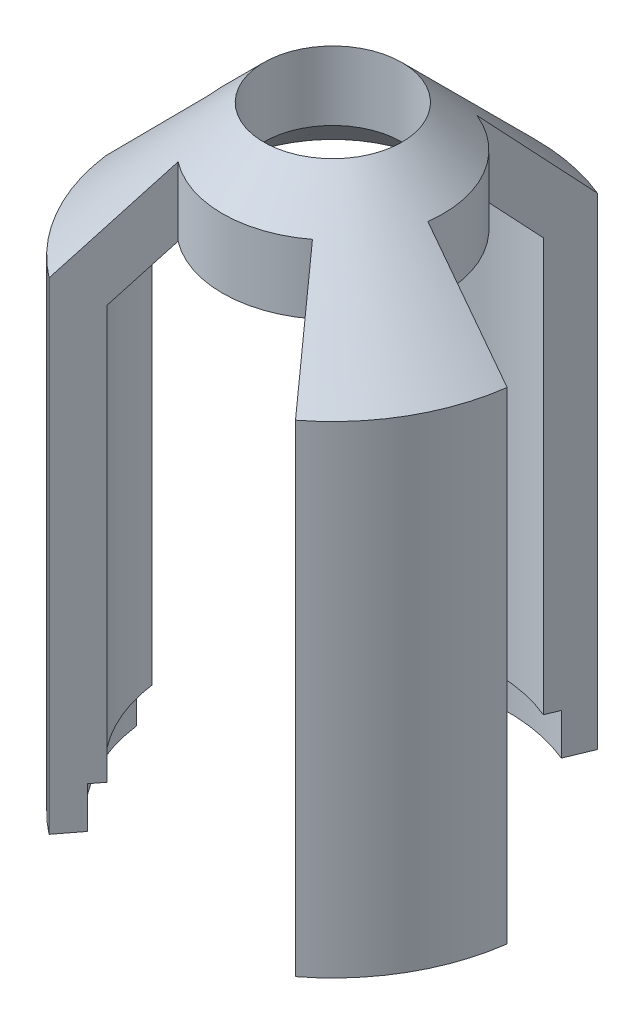
from build123d import *

# Parameters (mm, degrees)
CUT_EXTRUDE1_DEPTH = 50.284168097
CIRPATTERN1_COUNT  = 3


with BuildPart() as part:
    # Sketch1 → Revolve1 (revolve)
    with BuildSketch(Plane.XY):
        Polygon((5.015, 41.685), (5.015, 36.685), (11.7, 30), (11.7, 0), (12.7, 0), (12.7, -3), (14.7, -3), (14.7, 32), align=None)
    revolve(axis=Axis((0, -8.942247124, 0), (0, 1, 0)))

    # Sketch2 → Cut-Extrude1 (cut, through all)
    with BuildSketch(Plane.XZ.offset(3)):
        with BuildLine():
            Line((-8.948793006, 11.662294102), (-4.879222854, 6.358727022))
            ThreePointArc((-4.879222854, 6.358727022), (0, 8.015), (4.879222854, 6.358727022))
            Line((4.879222854, 6.358727022), (8.948793006, 11.662294102))
            ThreePointArc((8.948793006, 11.662294102), (0, 14.7), (-8.948793006, 11.662294102))
        make_face()
    cut_extrude1 = extrude(amount=-CUT_EXTRUDE1_DEPTH, mode=Mode.SUBTRACT)

    # CirPattern1: Cut-Extrude1 ×3 about axis
    cirpattern1_axis = Axis((0, -8.942247124, 0), (0, -1, 0))
    for i in range(1, CIRPATTERN1_COUNT):
        add(cut_extrude1.rotate(cirpattern1_axis, i * 360 / CIRPATTERN1_COUNT), mode=Mode.SUBTRACT)


solid = part.part
